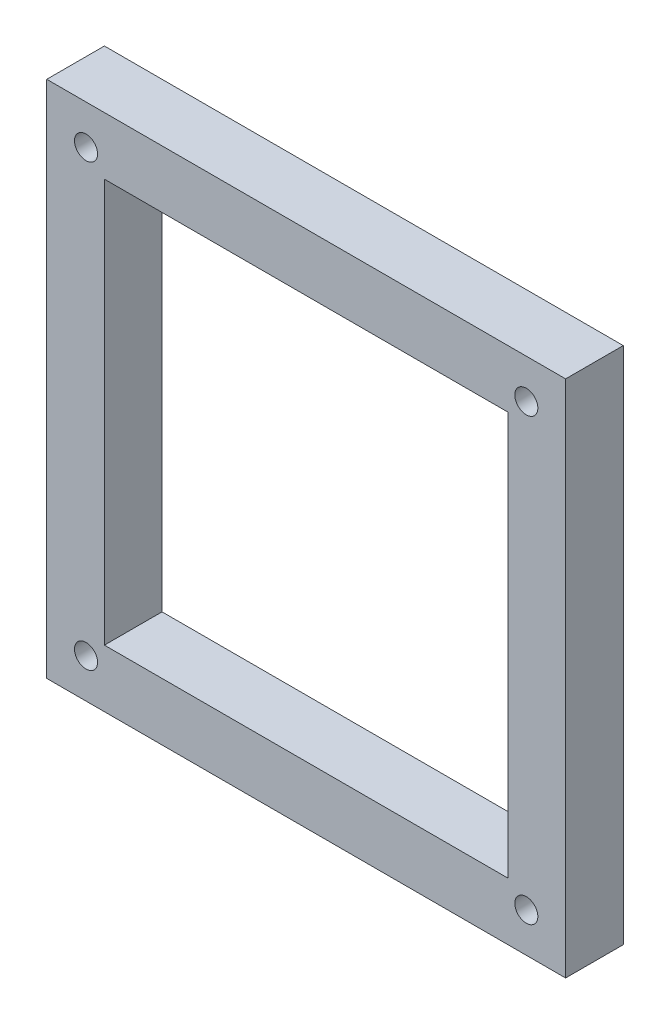
from build123d import *

# Parameters (mm, degrees)
SKETCH1_W           = 90
SKETCH1_H           = 90
SKETCH1_R           = 2
SKETCH1_W_2         = 70
SKETCH1_H_2         = 70
BOSS_EXTRUDE1_DEPTH = 10
SKETCH3_R           = 3.55
CUT_EXTRUDE1_DEPTH  = 5


with BuildPart() as part:
    # Sketch1 → Boss-Extrude1 (new body)
    with BuildSketch(Plane.XY):
        Rectangle(SKETCH1_W, SKETCH1_H)
        with Locations((-38.183766184, 38.183766184)):
            Circle(SKETCH1_R, mode=Mode.SUBTRACT)
        with Locations((38.183766184, 38.183766184)):
            Circle(SKETCH1_R, mode=Mode.SUBTRACT)
        with Locations((38.183766184, -38.183766184)):
            Circle(SKETCH1_R, mode=Mode.SUBTRACT)
        with Locations((-38.183766184, -38.183766184)):
            Circle(SKETCH1_R, mode=Mode.SUBTRACT)
        Rectangle(SKETCH1_W_2, SKETCH1_H_2, mode=Mode.SUBTRACT)
    extrude(amount=BOSS_EXTRUDE1_DEPTH)

    # Sketch3 → Cut-Extrude1 (cut)
    with BuildSketch(Plane(origin=(0, 0, 0), x_dir=(-1, 0, 0), z_dir=(0, 0, -1))):
        with Locations((-38.183766184, 38.183766184)):
            Circle(SKETCH3_R)
        with Locations((38.183766184, 38.183766184)):
            Circle(SKETCH3_R)
        with Locations((38.183766184, -38.183766184)):
            Circle(SKETCH3_R)
        with Locations((-38.183766184, -38.183766184)):
            Circle(SKETCH3_R)
    extrude(amount=-CUT_EXTRUDE1_DEPTH, mode=Mode.SUBTRACT)


solid = part.part
